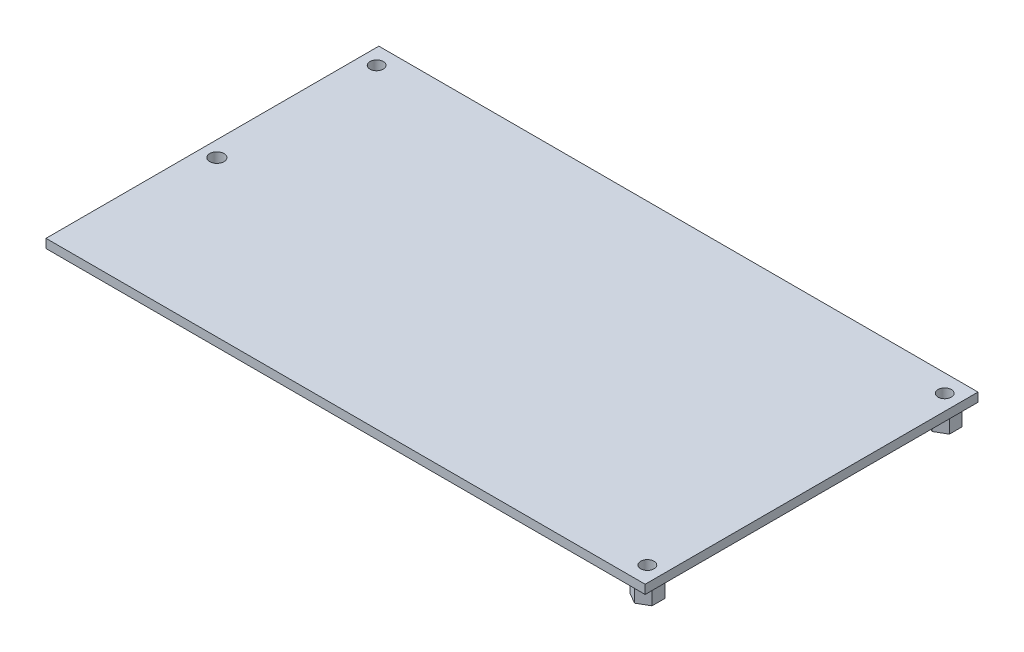
from build123d import *

# Parameters (mm, degrees)
SKETCH_1_W          = 135
SKETCH_1_H          = 75
SKETCH_1_R          = 1.5
SKETCH_1_R_2        = 1.6
EXTRUDE_1_DEPTH     = 2
EXTRUDE_2_DEPTH     = 4
SKETCH_3_R          = 1.5
SKETCH_3_R_2        = 1.6
CUT_EXTRUDE_1_DEPTH = 155.486245342


with BuildPart() as part:
    # Эскиз1 → Бобышка-Вытянуть1 (new body)
    with BuildSketch(Plane(origin=(0, 0, 0), x_dir=(1, 0, 0), z_dir=(0, 1, 0))):
        with Locations((67.5, 37.5)):
            Rectangle(SKETCH_1_W, SKETCH_1_H)
        with Locations((3.5, 71)):
            Circle(SKETCH_1_R, mode=Mode.SUBTRACT)
        with Locations((3.5, 35)):
            Circle(SKETCH_1_R_2, mode=Mode.SUBTRACT)
        with Locations((131.5, 71)):
            Circle(SKETCH_1_R, mode=Mode.SUBTRACT)
        with Locations((131.5, 4)):
            Circle(SKETCH_1_R, mode=Mode.SUBTRACT)
    extrude(amount=EXTRUDE_1_DEPTH)

    # Эскиз2 → Бобышка-Вытянуть2 (add)
    with BuildSketch(Plane.XZ):
        Polygon((3.5, -37.886751346), (6, -36.443375673), (6, -33.556624327), (3.5, -32.113248654), (1, -33.556624327), (1, -36.443375673), align=None)
        Polygon((3.5, -73.886751346), (6, -72.443375673), (6, -69.556624327), (3.5, -68.113248654), (1, -69.556624327), (1, -72.443375673), align=None)
        Polygon((131.5, -6.886751346), (134, -5.443375673), (134, -2.556624327), (131.5, -1.113248654), (129, -2.556624327), (129, -5.443375673), align=None)
        Polygon((129, -72.443375673), (131.5, -73.886751346), (134, -72.443375673), (134, -69.556624327), (131.5, -68.113248654), (129, -69.556624327), align=None)
    extrude(amount=EXTRUDE_2_DEPTH)

    # Эскиз3 → Вырез-Вытянуть1 (cut, through all)
    with BuildSketch(Plane(origin=(0, 0, 0), x_dir=(1, 0, 0), z_dir=(0, 1, 0))):
        with Locations((3.5, 71)):
            Circle(SKETCH_3_R)
        with Locations((131.5, 4)):
            Circle(SKETCH_3_R)
        with Locations((131.5, 71)):
            Circle(SKETCH_3_R)
        with Locations((3.5, 35)):
            Circle(SKETCH_3_R_2)
    extrude(amount=-CUT_EXTRUDE_1_DEPTH, mode=Mode.SUBTRACT)


solid = part.part
